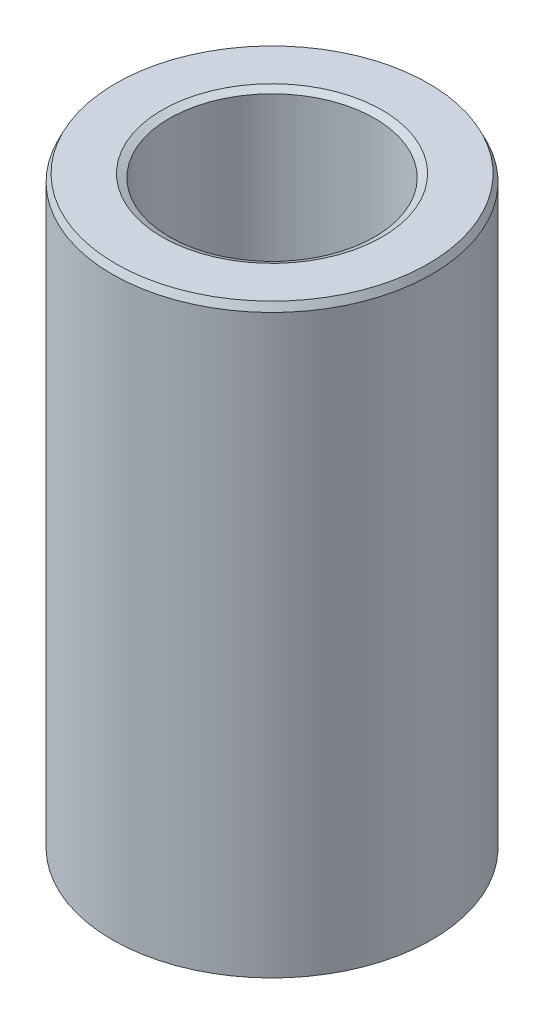
from build123d import *
from OCP.BRepFilletAPI import BRepFilletAPI_MakeChamfer

# Parameters (mm, degrees)
SKETCH1_R           = 52.5
BOSS_EXTRUDE1_DEPTH = 192.904847847
SKETCH2_R           = 33.73283181
CUT_EXTRUDE1_DEPTH  = 207.699734695
CHAMFER1_SIZE       = 2.410511473
CHAMFER1_SIZE2      = 1.153692424


with BuildPart() as part:
    # Sketch1 → Boss-Extrude1 (new body)
    with BuildSketch(Plane(origin=(0, 0, 0), x_dir=(1, 0, 0), z_dir=(0, 1, 0))):
        Circle(SKETCH1_R)
    extrude(amount=BOSS_EXTRUDE1_DEPTH)

    # Sketch2 → Cut-Extrude1 (cut, through all)
    with BuildSketch(Plane(origin=(0, 0, 0), x_dir=(1, 0, 0), z_dir=(0, 1, 0))):
        Circle(SKETCH2_R)
    extrude(amount=CUT_EXTRUDE1_DEPTH, mode=Mode.SUBTRACT)

    # Chamfer1: one chamfer whose edges measure the first distance from different faces: ONE call of the kernel's chamfer builder (chamfer() names one face for all edges)
    chamfer1_edges_1 = [part.edges().sort_by_distance(p)[0] for p in [
        (-33.73283181, 192.904847847, 0),
    ]]
    chamfer1_side_1 = [part.faces().sort_by_distance(p)[0] for p in [
        (-51.01507576, 192.904847847, 0),
    ]]
    chamfer1_edges_2 = [part.edges().sort_by_distance(p)[0] for p in [
        (-33.73283181, 0, 0),
    ]]
    chamfer1_side_2 = [part.faces().sort_by_distance(p)[0] for p in [
        (-33.73283181, 96.452423924, 0),
    ]]
    chamfer1_edges_3 = [part.edges().sort_by_distance(p)[0] for p in [
        (-52.5, 0, 0),
    ]]
    chamfer1_side_3 = [part.faces().sort_by_distance(p)[0] for p in [
        (-51.01507576, 0, 0),
    ]]
    chamfer1_edges_4 = [part.edges().sort_by_distance(p)[0] for p in [
        (-52.5, 192.904847847, 0),
    ]]
    chamfer1_side_4 = [part.faces().sort_by_distance(p)[0] for p in [
        (-52.5, 96.452423924, 0),
    ]]
    chamfer1 = BRepFilletAPI_MakeChamfer(part.part.solid().wrapped)
    for e in chamfer1_edges_1:
        chamfer1.Add(CHAMFER1_SIZE, CHAMFER1_SIZE2, e.wrapped, chamfer1_side_1[0].wrapped)  # the first distance lies on this face
    for e in chamfer1_edges_2:
        chamfer1.Add(CHAMFER1_SIZE, CHAMFER1_SIZE2, e.wrapped, chamfer1_side_2[0].wrapped)  # the first distance lies on this face
    for e in chamfer1_edges_3:
        chamfer1.Add(CHAMFER1_SIZE, CHAMFER1_SIZE2, e.wrapped, chamfer1_side_3[0].wrapped)  # the first distance lies on this face
    for e in chamfer1_edges_4:
        chamfer1.Add(CHAMFER1_SIZE, CHAMFER1_SIZE2, e.wrapped, chamfer1_side_4[0].wrapped)  # the first distance lies on this face
    add(Compound.cast(chamfer1.Shape()), mode=Mode.REPLACE)


solid = part.part
